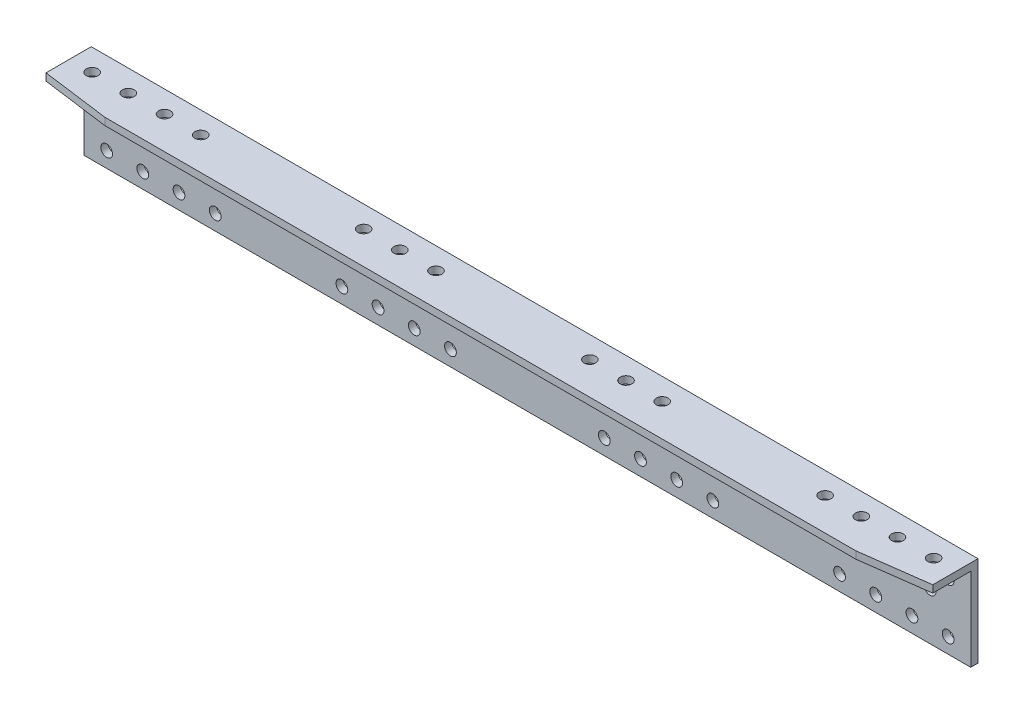
from build123d import *

# Parameters (mm, degrees)
SKETCH_1_W          = 1960
SKETCH_1_H          = 200
SKETCH_1_R          = 13
EXTRUDE_1566_DEPTH  = 16
SKETCH_2_W          = 1960
SKETCH_2_H          = 16
EXTRUDE_1_DEPTH     = 104
SKETCH_3_R          = 13
CUT_EXTRUDE_1_DEPTH = 1008.372820757


with BuildPart() as part:
    # 草图1 → Extrude 1566 (new body)
    with BuildSketch(Plane.XY):
        with Locations((0, 100)):
            Rectangle(SKETCH_1_W, SKETCH_1_H)
        with Locations((930, 146)):
            Circle(SKETCH_1_R, mode=Mode.SUBTRACT)
        with Locations((-890, 106)):
            Circle(SKETCH_1_R, mode=Mode.SUBTRACT)
        with Locations((850, 146)):
            Circle(SKETCH_1_R, mode=Mode.SUBTRACT)
        with Locations((930, 34)):
            Circle(SKETCH_1_R, mode=Mode.SUBTRACT)
        with Locations((850, 34)):
            Circle(SKETCH_1_R, mode=Mode.SUBTRACT)
        with Locations((-810, 106)):
            Circle(SKETCH_1_R, mode=Mode.SUBTRACT)
        with Locations((770, 34)):
            Circle(SKETCH_1_R, mode=Mode.SUBTRACT)
        with Locations((770, 146)):
            Circle(SKETCH_1_R, mode=Mode.SUBTRACT)
        with Locations((-730, 106)):
            Circle(SKETCH_1_R, mode=Mode.SUBTRACT)
        with Locations((690, 146)):
            Circle(SKETCH_1_R, mode=Mode.SUBTRACT)
        with Locations((690, 34)):
            Circle(SKETCH_1_R, mode=Mode.SUBTRACT)
        with Locations((-650, 106)):
            Circle(SKETCH_1_R, mode=Mode.SUBTRACT)
        with Locations((170, 146)):
            Circle(SKETCH_1_R, mode=Mode.SUBTRACT)
        with Locations((170, 34)):
            Circle(SKETCH_1_R, mode=Mode.SUBTRACT)
        with Locations((-410, 146)):
            Circle(SKETCH_1_R, mode=Mode.SUBTRACT)
        with Locations((250, 34)):
            Circle(SKETCH_1_R, mode=Mode.SUBTRACT)
        with Locations((250, 146)):
            Circle(SKETCH_1_R, mode=Mode.SUBTRACT)
        with Locations((-450, 106)):
            Circle(SKETCH_1_R, mode=Mode.SUBTRACT)
        with Locations((330, 34)):
            Circle(SKETCH_1_R, mode=Mode.SUBTRACT)
        with Locations((330, 146)):
            Circle(SKETCH_1_R, mode=Mode.SUBTRACT)
        with Locations((-370, 106)):
            Circle(SKETCH_1_R, mode=Mode.SUBTRACT)
        with Locations((-290, 106)):
            Circle(SKETCH_1_R, mode=Mode.SUBTRACT)
        with Locations((-210, 106)):
            Circle(SKETCH_1_R, mode=Mode.SUBTRACT)
        with Locations((890, 106)):
            Circle(SKETCH_1_R, mode=Mode.SUBTRACT)
        with Locations((810, 106)):
            Circle(SKETCH_1_R, mode=Mode.SUBTRACT)
        with Locations((650, 106)):
            Circle(SKETCH_1_R, mode=Mode.SUBTRACT)
        with Locations((730, 106)):
            Circle(SKETCH_1_R, mode=Mode.SUBTRACT)
        with Locations((-330, 146)):
            Circle(SKETCH_1_R, mode=Mode.SUBTRACT)
        with Locations((-330, 34)):
            Circle(SKETCH_1_R, mode=Mode.SUBTRACT)
        with Locations((410, 146)):
            Circle(SKETCH_1_R, mode=Mode.SUBTRACT)
        with Locations((-250, 146)):
            Circle(SKETCH_1_R, mode=Mode.SUBTRACT)
        with Locations((-250, 34)):
            Circle(SKETCH_1_R, mode=Mode.SUBTRACT)
        with Locations((450, 106)):
            Circle(SKETCH_1_R, mode=Mode.SUBTRACT)
        with Locations((-170, 34)):
            Circle(SKETCH_1_R, mode=Mode.SUBTRACT)
        with Locations((-170, 146)):
            Circle(SKETCH_1_R, mode=Mode.SUBTRACT)
        with Locations((370, 106)):
            Circle(SKETCH_1_R, mode=Mode.SUBTRACT)
        with Locations((-690, 146)):
            Circle(SKETCH_1_R, mode=Mode.SUBTRACT)
        with Locations((290, 106)):
            Circle(SKETCH_1_R, mode=Mode.SUBTRACT)
        with Locations((-770, 146)):
            Circle(SKETCH_1_R, mode=Mode.SUBTRACT)
        with Locations((210, 106)):
            Circle(SKETCH_1_R, mode=Mode.SUBTRACT)
        with Locations((-850, 146)):
            Circle(SKETCH_1_R, mode=Mode.SUBTRACT)
        with Locations((130, 106)):
            Circle(SKETCH_1_R, mode=Mode.SUBTRACT)
        with Locations((-930, 146)):
            Circle(SKETCH_1_R, mode=Mode.SUBTRACT)
        with Locations((-690, 34)):
            Circle(SKETCH_1_R, mode=Mode.SUBTRACT)
        with Locations((-770, 34)):
            Circle(SKETCH_1_R, mode=Mode.SUBTRACT)
        with Locations((-850, 34)):
            Circle(SKETCH_1_R, mode=Mode.SUBTRACT)
        with Locations((-930, 34)):
            Circle(SKETCH_1_R, mode=Mode.SUBTRACT)
        with Locations((-130, 106)):
            Circle(SKETCH_1_R, mode=Mode.SUBTRACT)
        with Locations((410, 34)):
            Circle(SKETCH_1_R, mode=Mode.SUBTRACT)
        with Locations((-410, 34)):
            Circle(SKETCH_1_R, mode=Mode.SUBTRACT)
    extrude(amount=EXTRUDE_1566_DEPTH)

    # 草图2 → 凸台-拉伸1 (add)
    with BuildSketch(Plane.XY.offset(16)):
        with Locations((0, 192)):
            Rectangle(SKETCH_2_W, SKETCH_2_H)
    extrude(amount=EXTRUDE_1_DEPTH)

    # 草图3 → 切除-拉伸1 (cut, through all)
    with BuildSketch(Plane(origin=(0, 200, 0), x_dir=(-1, 0, 0), z_dir=(0, 1, 0))):
        with Locations((-930, 48)):
            Circle(SKETCH_3_R)
        with Locations((-850, 48)):
            Circle(SKETCH_3_R)
        with Locations((-770, 48)):
            Circle(SKETCH_3_R)
        with Locations((-690, 48)):
            Circle(SKETCH_3_R)
        with Locations((-330, 48)):
            Circle(SKETCH_3_R)
        with Locations((-250, 48)):
            Circle(SKETCH_3_R)
        with Locations((-170, 48)):
            Circle(SKETCH_3_R)
        with Locations((170, 48)):
            Circle(SKETCH_3_R)
        with Locations((250, 48)):
            Circle(SKETCH_3_R)
        with Locations((330, 48)):
            Circle(SKETCH_3_R)
        with Locations((930, 48)):
            Circle(SKETCH_3_R)
        with Locations((850, 48)):
            Circle(SKETCH_3_R)
        with Locations((770, 48)):
            Circle(SKETCH_3_R)
        with Locations((690, 48)):
            Circle(SKETCH_3_R)
        Polygon((-980, 100), (-830, 120), (-980, 120), align=None)
        Polygon((980, 100), (830, 120), (980, 120), align=None)
    extrude(amount=-CUT_EXTRUDE_1_DEPTH, mode=Mode.SUBTRACT)


solid = part.part
